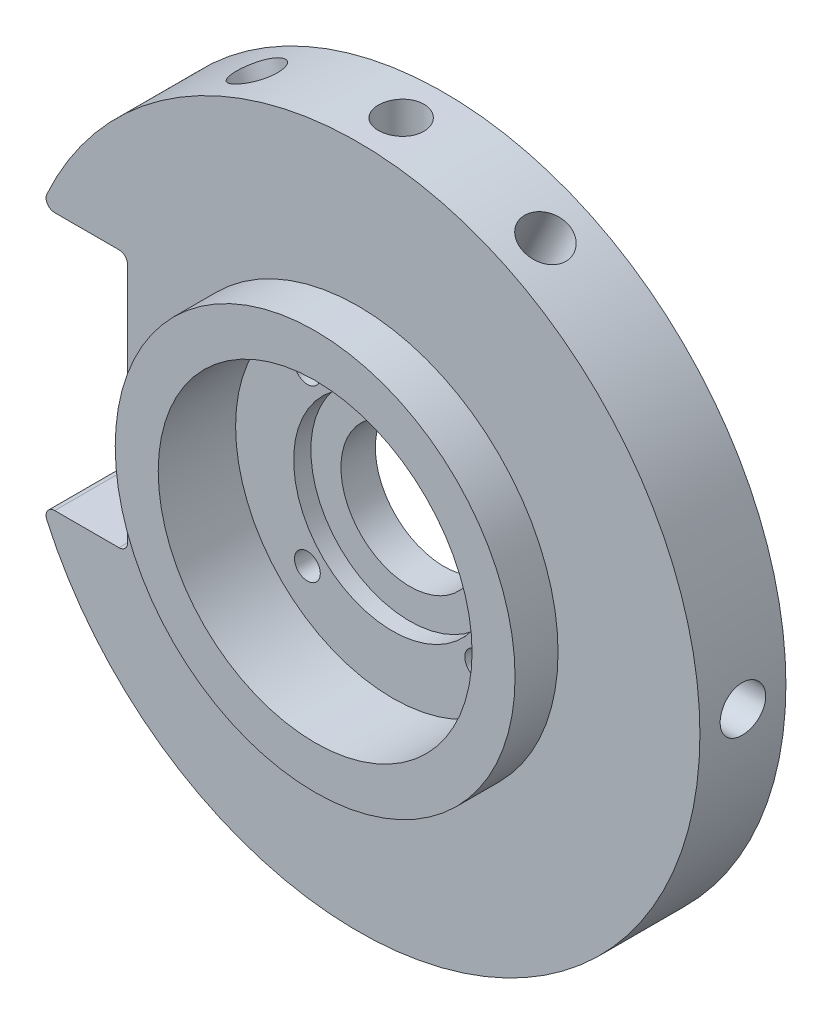
from build123d import *

# Parameters (mm, degrees)
SKETCH_1_R               = 39.75
EXTRUDE_1_DEPTH          = 10
SKETCH_2_R               = 18.25
CUT_EXTRUDE_1_DEPTH      = 4
SKETCH_3_R               = 11.5
CUT_EXTRUDE_2_DEPTH      = 2
SKETCH_4_R               = 1.5
CUT_EXTRUDE_3_DEPTH      = 6
SKETCH_5_R               = 3
CUT_EXTRUDE_4_DEPTH      = 2
SKETCH_7_R               = 2.65
CUT_EXTRUDE_5_DEPTH      = 8
PATTERN_CIRCULAR_1_COUNT = 2
PATTERN_CIRCULAR_1_ANGLE = 25
F_1_THE_OTHER_WAY_COUNT  = 2
F_1_THE_OTHER_WAY_ANGLE  = 25
MIRROR_1_COPY_1_SKETCH_R = 2.65
MIRROR_1_COPY_1_DEPTH    = 8
MIRROR_1_COPY_2_SKETCH_R = 2.65
MIRROR_1_COPY_2_DEPTH    = 8
SKETCH_8_R               = 8
CUT_EXTRUDE_6_DEPTH      = 4
SKETCH_9_R               = 2.65
CUT_EXTRUDE_7_DEPTH      = 8
PATTERN_CIRCULAR_2_COUNT = 2
EXTRUDE_START            = 5
SKETCH_10_R              = 23.25
SKETCH_10_R_2            = 18.25
EXTRUDE_2_DEPTH          = 5
CUT_EXTRUDE_START        = -10
CUT_EXTRUDE_8_DEPTH      = 10
FILLET_1_R               = 1


# Read off the part's stored shape, not the designer's step: Вырез-Вытянуть8
with BuildPart() as part:
    # Эскиз1 → Бобышка-Вытянуть1 (new body)
    with BuildSketch(Plane.XY):
        Circle(SKETCH_1_R)
    extrude(amount=EXTRUDE_1_DEPTH)

    # Эскиз2 → Вырез-Вытянуть1 (cut)
    with BuildSketch(Plane.XY.offset(10)):
        Circle(SKETCH_2_R)
    extrude(amount=-CUT_EXTRUDE_1_DEPTH, mode=Mode.SUBTRACT)

    # Эскиз3 → Вырез-Вытянуть2 (cut)
    with BuildSketch(Plane.XY.offset(6)):
        Circle(SKETCH_3_R)
    extrude(amount=-CUT_EXTRUDE_2_DEPTH, mode=Mode.SUBTRACT)

    # Эскиз4 → Вырез-Вытянуть3 (cut)
    with BuildSketch(Plane.XY.offset(6)):
        with Locations((-9.899494937, 9.899494937)):
            Circle(SKETCH_4_R)
        with Locations((9.899494937, 9.899494937)):
            Circle(SKETCH_4_R)
        with Locations((9.899494937, -9.899494937)):
            Circle(SKETCH_4_R)
        with Locations((-9.899494937, -9.899494937)):
            Circle(SKETCH_4_R)
    extrude(amount=-CUT_EXTRUDE_3_DEPTH, mode=Mode.SUBTRACT)

    # Эскиз5 → Вырез-Вытянуть4 (cut)
    with BuildSketch(Plane(origin=(0, 0, 0), x_dir=(-1, 0, 0), z_dir=(0, 0, -1))):
        with Locations((-9.899494937, 9.899494937)):
            Circle(SKETCH_5_R)
        with Locations((9.899494937, 9.899494937)):
            Circle(SKETCH_5_R)
        with Locations((9.899494937, -9.899494937)):
            Circle(SKETCH_5_R)
        with Locations((-9.899494937, -9.899494937)):
            Circle(SKETCH_5_R)
    extrude(amount=-CUT_EXTRUDE_4_DEPTH, mode=Mode.SUBTRACT)

    # Эскиз7 → Вырез-Вытянуть5 (cut)
    with BuildSketch(Plane(origin=(0, 39.75, 0), x_dir=(0, 0, -1), z_dir=(0, 1, 0))):
        with Locations(Location((-5, 0, 0), (0, 0, 90))):
            Circle(SKETCH_7_R)
    cut_extrude_5 = extrude(amount=-CUT_EXTRUDE_5_DEPTH, mode=Mode.SUBTRACT)

    # Круговой массив1: Вырез-Вытянуть5 ×2 about axis
    pattern_circular_1_axis = Axis((0, 0, 10), (0, 0, -1))
    for i in range(1, PATTERN_CIRCULAR_1_COUNT):
        add(cut_extrude_5.rotate(pattern_circular_1_axis, i * PATTERN_CIRCULAR_1_ANGLE / (PATTERN_CIRCULAR_1_COUNT - 1)), mode=Mode.SUBTRACT)

    # 1 the other way: Вырез-Вытянуть5 ×2 about axis
    f_1_the_other_way_axis = Axis((0, 0, 10), (0, 0, 1))
    for i in range(1, F_1_THE_OTHER_WAY_COUNT):
        add(cut_extrude_5.rotate(f_1_the_other_way_axis, i * F_1_THE_OTHER_WAY_ANGLE / (F_1_THE_OTHER_WAY_COUNT - 1)), mode=Mode.SUBTRACT)

    # Зеркальное отражение1: Вырез-Вытянуть5 across plane
    add(cut_extrude_5.mirror(Plane.ZX), mode=Mode.SUBTRACT)

    # Зеркальное отражение1 copy 1 sketch → Зеркальное отражение1 copy 1 (cut)
    with BuildSketch(Plane(origin=(16.799075904, -36.025734535, 0), x_dir=(0, 0, -1), z_dir=(0.4226182617407035, -0.906307787036648, 0))):
        with Locations((-5, 0)):
            Circle(MIRROR_1_COPY_1_SKETCH_R)
    extrude(amount=-MIRROR_1_COPY_1_DEPTH, mode=Mode.SUBTRACT)

    # Зеркальное отражение1 copy 2 sketch → Зеркальное отражение1 copy 2 (cut)
    with BuildSketch(Plane(origin=(-16.799075904, -36.025734535, 0), x_dir=(0, 0, -1), z_dir=(-0.42261826174069717, -0.9063077870366509, 0))):
        with Locations((-5, 0)):
            Circle(MIRROR_1_COPY_2_SKETCH_R)
    extrude(amount=-MIRROR_1_COPY_2_DEPTH, mode=Mode.SUBTRACT)

    # Эскиз8 → Вырез-Вытянуть6 (cut)
    with BuildSketch(Plane.XY.offset(4)):
        Circle(SKETCH_8_R)
    extrude(amount=-CUT_EXTRUDE_6_DEPTH, mode=Mode.SUBTRACT)

    # Эскиз9 → Вырез-Вытянуть7 (cut)
    with BuildSketch(Plane.ZY.offset(39.75)):
        with Locations((5, 0)):
            Circle(SKETCH_9_R)
    cut_extrude_7 = extrude(amount=-CUT_EXTRUDE_7_DEPTH, mode=Mode.SUBTRACT)

    # Круговой массив2: Вырез-Вытянуть7 ×2 about axis
    pattern_circular_2_axis = Axis((0, 0, 10), (0, 0, -1))
    for i in range(1, PATTERN_CIRCULAR_2_COUNT):
        add(cut_extrude_7.rotate(pattern_circular_2_axis, i * 360 / PATTERN_CIRCULAR_2_COUNT), mode=Mode.SUBTRACT)

    # Эскиз10 → Бобышка-Вытянуть2 (add)
    with BuildSketch(Plane.XY.offset(10).offset(EXTRUDE_START)):
        Circle(SKETCH_10_R)
        Circle(SKETCH_10_R_2, mode=Mode.SUBTRACT)
    extrude(amount=-EXTRUDE_2_DEPTH)

    # Вырез-Вытянуть8 outline → Вырез-Вытянуть8 (cut)
    with BuildSketch(Plane(origin=(0, 0, 0), x_dir=(-1, 0, 0), z_dir=(0, 0, -1)).offset(CUT_EXTRUDE_START)):
        with BuildLine():
            Line((36.811173575, 15), (26.811173575, 15))
            Line((26.811173575, 15), (26.811173575, -15))
            Line((26.811173575, -15), (36.811173575, -15))
            ThreePointArc((36.811173575, -15), (39.75, 0), (36.811173575, 15))
        make_face()
    extrude(amount=CUT_EXTRUDE_8_DEPTH, mode=Mode.SUBTRACT)

    # Скругление1
    fillet_1_edges = [part.edges().sort_by_distance(p)[0] for p in [
        (-26.811173575, 15, 5),
        (-26.811173575, -15, 5),
        (-36.811173575, -15, 5),
        (-36.811173575, 15, 5),
    ]]
    fillet(fillet_1_edges, radius=FILLET_1_R)


solid = part.part
